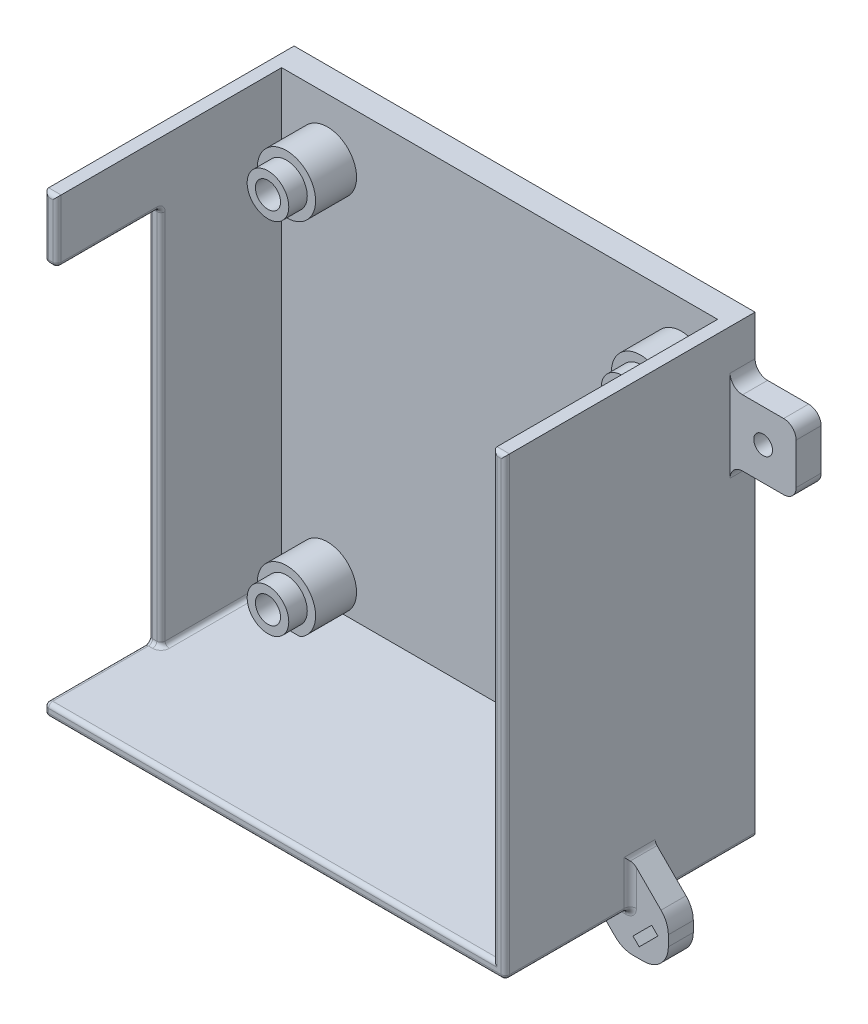
from build123d import *

# Parameters (mm, degrees)
SKETCH1_W            = 104.775
SKETCH1_H            = 106.3625
BOSS_EXTRUDE1_DEPTH  = 6
BOSS_EXTRUDE2_DEPTH  = 35
SKETCH3_R            = 5
SKETCH3_R_2          = 3.025
BOSS_EXTRUDE3_DEPTH  = 14.2875
SKETCH4_R            = 7
SKETCH4_R_2          = 3.025
BOSS_EXTRUDE4_DEPTH  = 9.8425
SKETCH6_W            = 15.875
SKETCH6_H            = 15.875
SKETCH6_W_2          = 15.88
SKETCH6_H_2          = 15.88
BOSS_EXTRUDE5_DEPTH  = 6
M4_CLEARANCE_HOLE1_D = 4.5
FILLET2_R            = 3
SKETCH9_W            = 3
SKETCH9_H            = 15
BOSS_EXTRUDE6_DEPTH  = 25
FILLET3_R            = 1
BOSS_EXTRUDE7_START  = 6
BOSS_EXTRUDE7_DEPTH  = 6
FILLET4_R            = 6
FILLET5_R            = 1.5


with BuildPart() as part:
    # Sketch1 → Boss-Extrude1 (new body)
    with BuildSketch(Plane.XY):
        Rectangle(SKETCH1_W, SKETCH1_H)
    extrude(amount=BOSS_EXTRUDE1_DEPTH)

    # Sketch2 → Boss-Extrude2 (add)
    with BuildSketch(Plane.XY):
        Polygon((-55.3875, -53.18125), (-55.3875, -56.18125), (-52.3875, -56.18125), (55.3875, -56.18125), (55.3875, 53.18125), (52.3875, 53.18125), (52.3875, -53.18125), (-52.3875, -53.18125), (-52.3875, 53.18125), (-55.3875, 53.18125), align=None)
    extrude(amount=BOSS_EXTRUDE2_DEPTH)

    # Sketch3 → Boss-Extrude3 (add)
    # profile 1 of 4: a face of its own
    with BuildSketch(Plane.XY.offset(6)):
        with Locations((43.708, 39.35095)):
            Circle(SKETCH3_R)
        with Locations((43.708, 39.35095)):
            Circle(SKETCH3_R_2, mode=Mode.SUBTRACT)
    # profile 2 of 4: a face of its own
    with BuildSketch(Plane.XY.offset(6)):
        with Locations((-41.382, 39.35095)):
            Circle(SKETCH3_R)
        with Locations((-41.382, 39.35095)):
            Circle(SKETCH3_R_2, mode=Mode.SUBTRACT)
    # profile 3 of 4: a face of its own
    with BuildSketch(Plane.XY.offset(6)):
        with Locations((-41.382, -47.00905)):
            Circle(SKETCH3_R)
        with Locations((-41.382, -47.00905)):
            Circle(SKETCH3_R_2, mode=Mode.SUBTRACT)
    # profile 4 of 4: a face of its own
    with BuildSketch(Plane.XY.offset(6)):
        with Locations((43.708, -47.00905)):
            Circle(SKETCH3_R)
        with Locations((43.708, -47.00905)):
            Circle(SKETCH3_R_2, mode=Mode.SUBTRACT)
    extrude(amount=BOSS_EXTRUDE3_DEPTH)

    # Sketch4 → Boss-Extrude4 (add)
    # profile 1 of 4: a face of its own
    with BuildSketch(Plane.XY.offset(6)):
        with Locations((43.708, 39.35095)):
            Circle(SKETCH4_R)
        with Locations((43.708, 39.35095)):
            Circle(SKETCH4_R_2, mode=Mode.SUBTRACT)
    # profile 2 of 4: a face of its own
    with BuildSketch(Plane.XY.offset(6)):
        with Locations((-41.382, 39.35095)):
            Circle(SKETCH4_R)
        with Locations((-41.382, 39.35095)):
            Circle(SKETCH4_R_2, mode=Mode.SUBTRACT)
    # profile 3 of 4: a face of its own
    with BuildSketch(Plane.XY.offset(6)):
        with Locations((-41.382, -47.00905)):
            Circle(SKETCH4_R)
        with Locations((-41.382, -47.00905)):
            Circle(SKETCH4_R_2, mode=Mode.SUBTRACT)
    # profile 4 of 4: a face of its own
    with BuildSketch(Plane.XY.offset(6)):
        with Locations((43.708, -47.00905)):
            Circle(SKETCH4_R)
        with Locations((43.708, -47.00905)):
            Circle(SKETCH4_R_2, mode=Mode.SUBTRACT)
    extrude(amount=BOSS_EXTRUDE4_DEPTH)

    # Sketch6 → Boss-Extrude5 (add)
    with BuildSketch(Plane.XY):
        with Locations((63.325, 32.54375)):
            Rectangle(SKETCH6_W, SKETCH6_H)
        with Locations((-63.3275, -48.24125)):
            Rectangle(SKETCH6_W_2, SKETCH6_H_2)
    extrude(amount=BOSS_EXTRUDE5_DEPTH)

    # M4 Clearance Hole1 (through all)
    with Locations(Plane.XY.offset(6)):
        with Locations((63.325, 32.54375), (-63.3275, -48.24125)):
            Hole(M4_CLEARANCE_HOLE1_D / 2)

    # Fillet2
    fillet2_edges = [part.edges().sort_by_distance(p)[0] for p in [
        (71.2625, 24.60625, 3),
        (71.2625, 40.48125, 3),
        (55.3875, 40.48125, 3),
        (55.3875, 24.60625, 3),
        (-71.2675, -56.18125, 3),
        (-71.2675, -40.30125, 3),
    ]]
    fillet(fillet2_edges, radius=FILLET2_R)

    # Sketch9 → Boss-Extrude6 (add)
    with BuildSketch(Plane.XY.offset(35)):
        with Locations((-53.8875, 45.68125)):
            Rectangle(SKETCH9_W, SKETCH9_H)
        Polygon((52.3875, -53.18125), (-55.3875, -53.18125), (-55.3875, -56.18125), (55.3875, -56.18125), (55.3875, 53.18125), (52.3875, 53.18125), align=None)
    extrude(amount=BOSS_EXTRUDE6_DEPTH)

    # Fillet3
    fillet3_edges = [part.edges().sort_by_distance(p)[0] for p in [
        (-53.8875, -53.18125, 35),
        (55.3875, -56.18125, 30),
        (-55.3875, -7.5, 35),
        (-52.3875, -7.5, 35),
        (-52.3875, -53.18125, 20.5),
        (-55.3875, -56.18125, 33),
        (-52.3875, 38.18125, 47.5),
        (-55.3875, -53.18125, 47.5),
        (-55.3875, 38.18125, 47.5),
        (-53.8875, 38.18125, 35),
        (52.3875, 0, 60),
        (53.8875, 53.18125, 60),
        (55.3875, -1.5, 60),
        (0, -56.18125, 60),
        (-55.3875, -54.68125, 60),
        (-1.5, -53.18125, 60),
        (-55.3875, 45.68125, 60),
        (-53.8875, 53.18125, 60),
        (-52.3875, 45.68125, 60),
        (-53.8875, 38.18125, 60),
    ]]
    fillet(fillet3_edges, radius=FILLET3_R)

    # Sketch10 → Boss-Extrude7 (add)
    with BuildSketch(Plane(origin=(0, 0, 30), x_dir=(-1, 0, 0), z_dir=(0, 0, -1)).offset(BOSS_EXTRUDE7_START)):
        with BuildLine():
            ThreePointArc((-54.3875, -56.18125), (-54.770183432, -56.105129533), (-55.094606781, -55.888356781))
            ThreePointArc((-55.094606781, -55.888356781), (-55.311379533, -55.563933432), (-55.3875, -55.18125))
            Line((-55.3875, -55.18125), (-55.3875, -45.18125))
            Line((-55.3875, -45.18125), (-64.544354249, -54.338104249))
            Line((-64.544354249, -54.338104249), (-64.544354249, -65.338104249))
            Line((-64.544354249, -65.338104249), (-53.544354249, -65.338104249))
            Line((-53.544354249, -65.338104249), (-44.3875, -56.18125))
            Line((-44.3875, -56.18125), (-54.3875, -56.18125))
        make_face()
        Polygon((-56.044354249, -61.338104249), (-57.544354249, -62.838104249), (-62.044354249, -58.338104249), (-60.544354249, -56.838104249), align=None, mode=Mode.SUBTRACT)
    extrude(amount=-BOSS_EXTRUDE7_DEPTH)

    # Fillet4
    fillet4_edges = [part.edges().sort_by_distance(p)[0] for p in [
        (64.544354249, -54.338104249, 27),
        (64.544354249, -65.338104249, 27),
        (53.544354249, -65.338104249, 27),
    ]]
    fillet(fillet4_edges, radius=FILLET4_R)

    # Fillet5
    fillet5_edges = [part.edges().sort_by_distance(p)[0] for p in [
        (55.3875, -50.18125, 30),
        (55.094606781, -55.888356781, 30),
        (55.3875, -45.18125, 27),
        (44.3875, -56.18125, 27),
        (49.3875, -56.18125, 30),
    ]]
    fillet(fillet5_edges, radius=FILLET5_R)


solid = part.part
